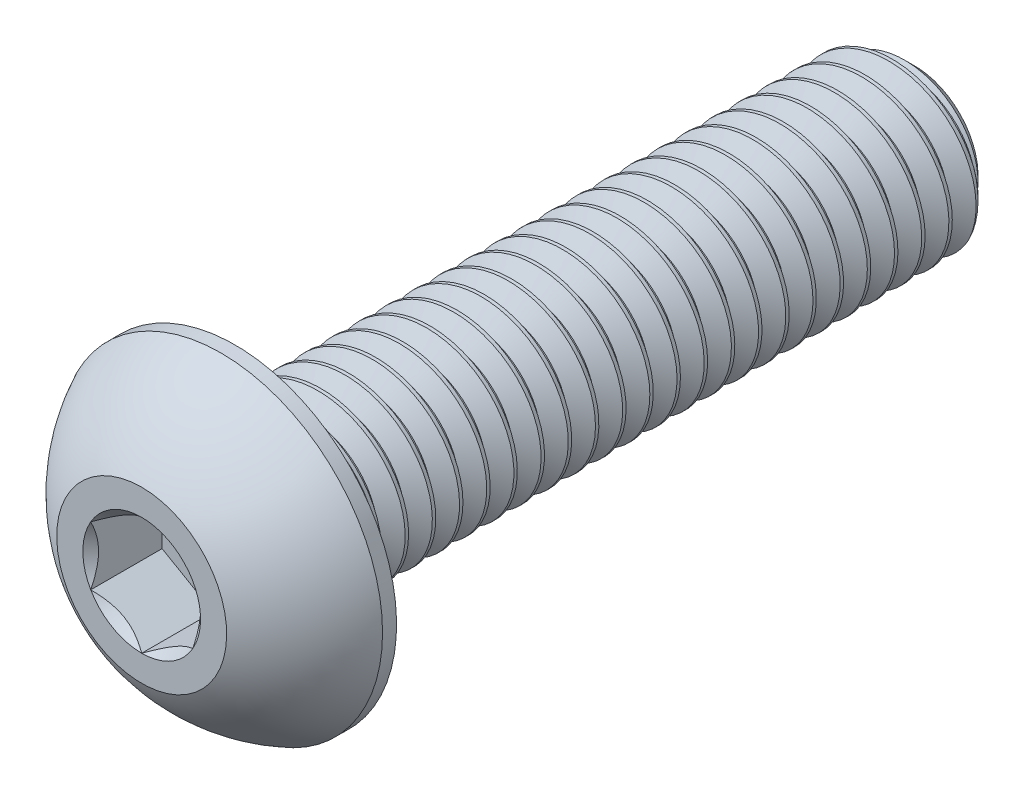
from build123d import *

# Parameters (mm, degrees)
CUT_EXTRUDE1_DEPTH = 2.1
CUT_SWEEP1_PITCH   = 0.8
CUT_SWEEP1_TO      = 20


with BuildPart() as part:
    # Sketch2 → Revolve1 (revolve)
    with BuildSketch(Plane(origin=(0, 0, 0), x_dir=(0, 0, -1), z_dir=(1, 0, 0)), mode=Mode.PRIVATE) as revolve1_sk:
        with BuildLine():
            Line((-11.375, 0), (11.375, 0))
            Line((11.375, 0), (11.375, 1.86))
            Line((11.375, 1.86), (10.735, 2.5))
            Line((10.735, 2.5), (-8.625, 2.5))
            Line((-8.625, 2.5), (-8.625, 4.75))
            Line((-8.625, 4.75), (-9.0375, 4.75))
            ThreePointArc((-9.0375, 4.75), (-10.383124817, 3.808753282), (-11.375, 2.5))
            Line((-11.375, 2.5), (-11.375, 0))
        make_face()
    revolve(revolve1_sk.sketch.rotate(Axis((0, 0, 11.375), (0, 0, -1)), 180), axis=Axis((0, 0, 11.375), (0, 0, -1)))

    # Sketch3 → Cut-Extrude1 (cut)
    with BuildSketch(Plane.XY.offset(11.375)):
        Polygon((0, 1.732050808), (-1.5, 0.866025404), (-1.5, -0.866025404), (0, -1.732050808), (1.5, -0.866025404), (1.5, 0.866025404), align=None)
    extrude(amount=-CUT_EXTRUDE1_DEPTH, mode=Mode.SUBTRACT)

    # Cut-Extrude2 cone 1 section (through the dimple's axis) → Cut-Extrude2 (revolve, cut)
    with BuildSketch(Plane(origin=(0, 0, 11.375), x_dir=(0, -1, 0), z_dir=(1, 0, 0))):
        Polygon((0, 0), (1.732050808, 0), (0, 1.732050808), align=None)
    revolve(axis=Axis((0, 0, 11.375), (0, 0, -1)), mode=Mode.SUBTRACT)


with BuildPart() as body_2:
    # Split1: read off the stored shape, not the designer's step
    # Split1: the piece on the far side of the plane
    add(part.part)
    split(bisect_by=Plane.XY.offset(8.625), keep=Keep.BOTTOM)

    # Cut-Sweep1: arcs per turn and ends read off the stored shape
    # Cut-Sweep1: the profile of Sketch6 screwed along a right-hand helix through 26 turns, 8 arcs to a turn; built about Z, then put on its axis
    cut_sweep1_z = Axis((0, 0, 0), (0, 0, 1))
    cut_sweep1_corners = [(1.980384758, 0, -0.3), (1.980384758, 0, -0.4), (2.54330127, 0, -0.725), (2.54330127, 0, 0.025)]
    with BuildLine(mode=Mode.PRIVATE) as cut_sweep1_profile:
        Line(cut_sweep1_corners[0], cut_sweep1_corners[1])
        Line(cut_sweep1_corners[1], cut_sweep1_corners[2])
        Line(cut_sweep1_corners[2], cut_sweep1_corners[3])
        Line(cut_sweep1_corners[3], cut_sweep1_corners[0])
    cut_sweep1_cap = Face(cut_sweep1_profile.wire())
    cut_sweep1_turn_angles = [0, 22.5, 45, 67.5, 90, 112.5, 135, 157.5, 180, 202.5, 225, 247.5, 270, 292.5, 315, 337.5, 360]
    cut_sweep1_turn_weights = [1, 0.9238795325112867, 1, 0.9238795325112867, 1, 0.9238795325112867, 1, 0.9238795325112867, 1, 0.9238795325112867, 1, 0.9238795325112867, 1, 0.9238795325112867, 1, 0.9238795325112867, 1]
    cut_sweep1_turn_rails = [Edge.make_bspline([Vector(p[0], p[1], 0).rotate(cut_sweep1_z, cut_sweep1_turn_angles[k]) / cut_sweep1_turn_weights[k] + Vector(0, 0, p[2] + CUT_SWEEP1_PITCH * cut_sweep1_turn_angles[k] / 360) for k in range(17)], [0, 0, 0, 1, 1, 2, 2, 3, 3, 4, 4, 5, 5, 6, 6, 7, 7, 8, 8, 8], 2, cut_sweep1_turn_weights) for p in cut_sweep1_corners]
    cut_sweep1_turn_sides = [Face.make_surface_from_curves(cut_sweep1_turn_rails[p[0]], cut_sweep1_turn_rails[p[1]]) for p in [(0, 1), (1, 2), (2, 3), (3, 0)]]
    cut_sweep1 = Plane(origin=(0, 0, -11.375), x_dir=(0, 1, 0), z_dir=(0, 0, 1)) * split(Solid(Shell([*[p.moved(Location((0, 0, CUT_SWEEP1_PITCH * i))) for i in range(26) for p in cut_sweep1_turn_sides], cut_sweep1_cap, cut_sweep1_cap.rotate(cut_sweep1_z, 9360).moved(Location((0, 0, CUT_SWEEP1_PITCH * 9360 / 360)))])), bisect_by=Plane.XY.offset(CUT_SWEEP1_TO), keep=Keep.BOTTOM, mode=Mode.PRIVATE)
    add(cut_sweep1, mode=Mode.SUBTRACT)


with BuildPart() as part_1:
    add(part.part)

    # Split1
    split(bisect_by=Plane.XY.offset(8.625), keep=Keep.TOP)

    add(body_2.part)  # Boss-Extrude1 merges body 2
    # Boss-Extrude1: read off the stored shape, not the designer's step
    # Boss-Extrude1 outline → Boss-Extrude1 (revolve)
    with BuildSketch(Plane.XZ):
        Polygon((1.980382722, 8.625), (1.980382722, 7.724996474), (2.5, 8.625), align=None)
    revolve(axis=Axis((0, 0, 0), (0, 0, 1)))


solid = part_1.part
